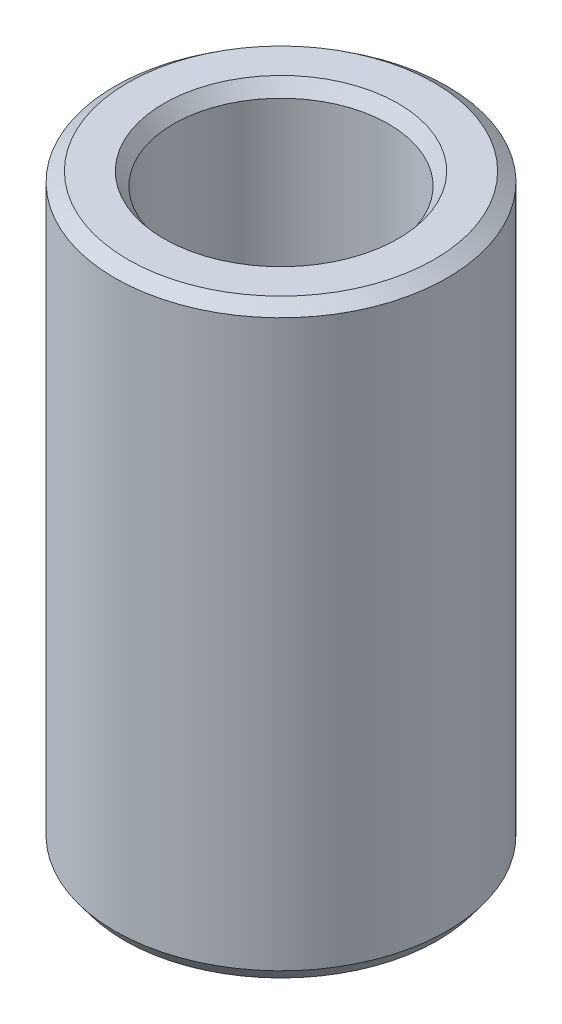
from build123d import *
from OCP.BRepFilletAPI import BRepFilletAPI_MakeChamfer

# Parameters (mm, degrees)
SKETCH1_R           = 37.5
BOSS_EXTRUDE1_DEPTH = 132.735458222
SKETCH2_R           = 24.280365317
CUT_EXTRUDE1_DEPTH  = 143.937755228
CHAMFER1_SIZE       = 2.164037315
CHAMFER1_SIZE2      = 2.925566815


with BuildPart() as part:
    # Sketch1 → Boss-Extrude1 (new body)
    with BuildSketch(Plane(origin=(0, 0, 0), x_dir=(1, 0, 0), z_dir=(0, 1, 0))):
        Circle(SKETCH1_R)
    extrude(amount=BOSS_EXTRUDE1_DEPTH)

    # Sketch2 → Cut-Extrude1 (cut, through all)
    with BuildSketch(Plane(origin=(0, 0, 0), x_dir=(1, 0, 0), z_dir=(0, 1, 0))):
        Circle(SKETCH2_R)
    extrude(amount=CUT_EXTRUDE1_DEPTH, mode=Mode.SUBTRACT)

    # Chamfer1: one chamfer whose edges measure the first distance from different faces: ONE call of the kernel's chamfer builder (chamfer() names one face for all edges)
    chamfer1_edges_1 = [part.edges().sort_by_distance(p)[0] for p in [
        (-24.280365317, 132.735458222, 0),
    ]]
    chamfer1_side_1 = [part.faces().sort_by_distance(p)[0] for p in [
        (-36.439339828, 132.735458222, 0),
    ]]
    chamfer1_edges_2 = [part.edges().sort_by_distance(p)[0] for p in [
        (-24.280365317, 0, 0),
    ]]
    chamfer1_side_2 = [part.faces().sort_by_distance(p)[0] for p in [
        (-24.280365317, 66.367729111, 0),
    ]]
    chamfer1_edges_3 = [part.edges().sort_by_distance(p)[0] for p in [
        (-37.5, 0, 0),
    ]]
    chamfer1_side_3 = [part.faces().sort_by_distance(p)[0] for p in [
        (-36.439339828, 0, 0),
    ]]
    chamfer1_edges_4 = [part.edges().sort_by_distance(p)[0] for p in [
        (-37.5, 132.735458222, 0),
    ]]
    chamfer1_side_4 = [part.faces().sort_by_distance(p)[0] for p in [
        (-37.5, 66.367729111, 0),
    ]]
    chamfer1 = BRepFilletAPI_MakeChamfer(part.part.solid().wrapped)
    for e in chamfer1_edges_1:
        chamfer1.Add(CHAMFER1_SIZE, CHAMFER1_SIZE2, e.wrapped, chamfer1_side_1[0].wrapped)  # the first distance lies on this face
    for e in chamfer1_edges_2:
        chamfer1.Add(CHAMFER1_SIZE, CHAMFER1_SIZE2, e.wrapped, chamfer1_side_2[0].wrapped)  # the first distance lies on this face
    for e in chamfer1_edges_3:
        chamfer1.Add(CHAMFER1_SIZE, CHAMFER1_SIZE2, e.wrapped, chamfer1_side_3[0].wrapped)  # the first distance lies on this face
    for e in chamfer1_edges_4:
        chamfer1.Add(CHAMFER1_SIZE, CHAMFER1_SIZE2, e.wrapped, chamfer1_side_4[0].wrapped)  # the first distance lies on this face
    add(Compound.cast(chamfer1.Shape()), mode=Mode.REPLACE)


solid = part.part
